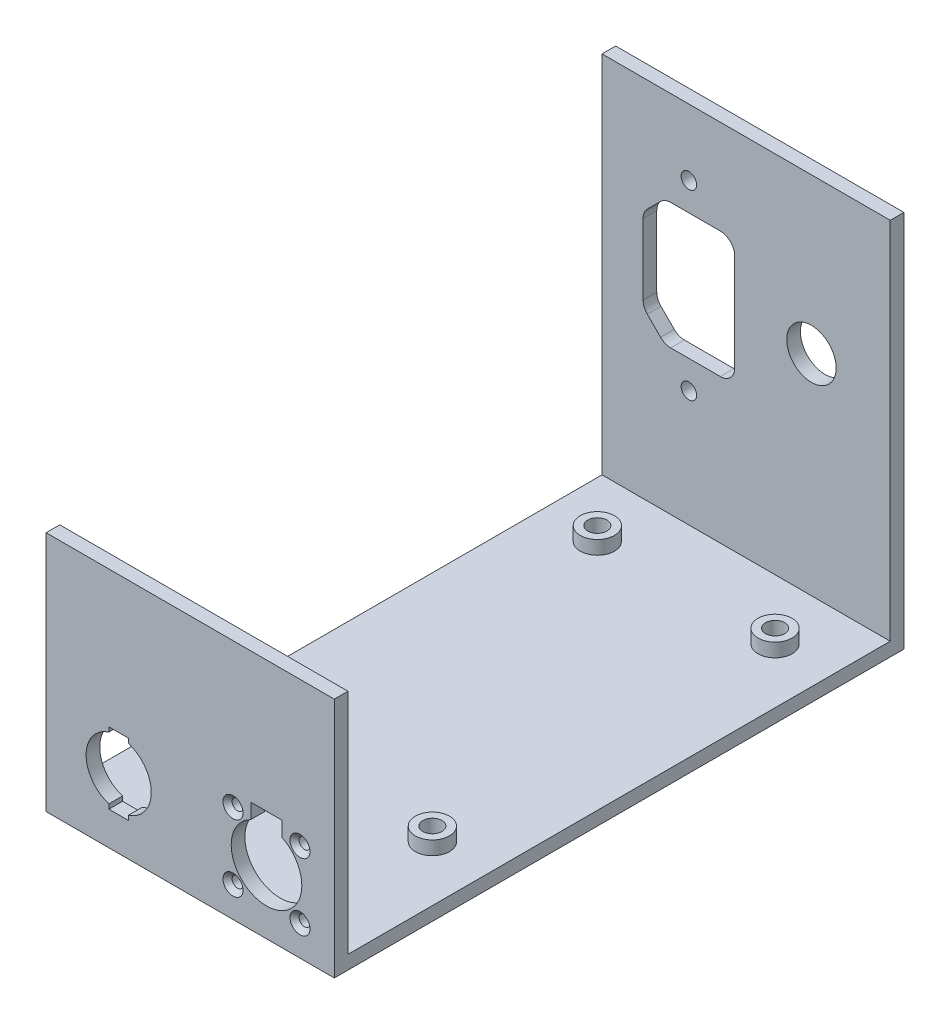
from build123d import *

# Parameters (mm, degrees)
SKETCH_2_R                  = 3.75
EXTRUDE_1_DEPTH             = 3
EXTRUDE_1_2_DEPTH           = 3
EXTRUDE_1_3_DEPTH           = 3
EXTRUDE_1_4_DEPTH           = 3
SKETCH_3_W                  = 63.25
SKETCH_3_H                  = 125
EXTRUDE_2_DEPTH             = 3
SKETCH_4_R                  = 2.1
CUT_EXTRUDE_1_DEPTH         = 4
SKETCH_5_W                  = 63.25
SKETCH_5_H                  = 3
EXTRUDE_3_DEPTH             = 50
CUT_EXTRUDE_2_DEPTH         = 10
HOLE_WIZARD_M21_D           = 2.4
HOLE_WIZARD_M21_DEPTH       = 5
HOLE_WIZARD_M21_CSINK_D     = 4.4
HOLE_WIZARD_M21_CSINK_ANGLE = 90
HOLE_WIZARD_M21_TIP         = 0.721032743
SKETCH_12_W                 = 63.25
SKETCH_12_H                 = 3
EXTRUDE_4_DEPTH             = 80
CUT_EXTRUDE_3_DEPTH         = 148.69272367
HOLE_WIZARD_M31_D           = 3.4
HOLE_WIZARD_M31_DEPTH       = 10
HOLE_WIZARD_M31_TIP         = 1.021463052
SKETCH_16_R                 = 5.425
CUT_EXTRUDE_4_DEPTH         = 148.69272367
CUT_EXTRUDE_5_DEPTH         = 148.69272367


with BuildPart() as part:
    # Эскиз2 → Бобышка-Вытянуть1 (new body)
    with BuildSketch(Plane.XZ):
        with Locations((19.5, 37.6)):
            Circle(SKETCH_2_R)
    extrude(amount=EXTRUDE_1_DEPTH)



with BuildPart() as body_2:
    # Эскиз2 → Extrude 1 2 (new body)
    with BuildSketch(Plane.XZ):
        with Locations((19.5, -37.6)):
            Circle(SKETCH_2_R)
    extrude(amount=EXTRUDE_1_2_DEPTH)


with BuildPart() as body_3:
    # Эскиз2 → Extrude 1 3 (new body)
    with BuildSketch(Plane.XZ):
        with Locations((-19.5, -37.6)):
            Circle(SKETCH_2_R)
    extrude(amount=EXTRUDE_1_3_DEPTH)


with BuildPart() as body_4:
    # Эскиз2 → Extrude 1 4 (new body)
    with BuildSketch(Plane.XZ):
        with Locations((-19.5, 37.6)):
            Circle(SKETCH_2_R)
    extrude(amount=EXTRUDE_1_4_DEPTH)


with BuildPart() as part_1:
    add(part.part)

    add(body_2.part)  # Бобышка-Вытянуть2 merges body 2

    add(body_3.part)  # Бобышка-Вытянуть2 merges body 3

    add(body_4.part)  # Бобышка-Вытянуть2 merges body 4
    # Эскиз3 → Бобышка-Вытянуть2 (add)
    with BuildSketch(Plane.XZ.offset(3)):
        with Locations((0, 8.75)):
            Rectangle(SKETCH_3_W, SKETCH_3_H)
    extrude(amount=EXTRUDE_2_DEPTH)

    # Эскиз4 → Вырез-Вытянуть1 (cut)
    with BuildSketch(Plane(origin=(0, 0, 0), x_dir=(1, 0, 0), z_dir=(0, 1, 0))):
        with Locations((19.5, 37.6)):
            Circle(SKETCH_4_R)
        with Locations((19.5, -37.6)):
            Circle(SKETCH_4_R)
        with Locations((-19.5, -37.6)):
            Circle(SKETCH_4_R)
        with Locations((-19.5, 37.6)):
            Circle(SKETCH_4_R)
    extrude(amount=-CUT_EXTRUDE_1_DEPTH, mode=Mode.SUBTRACT)

    # Эскиз5 → Бобышка-Вытянуть3 (add)
    with BuildSketch(Plane(origin=(0, -3, 0), x_dir=(1, 0, 0), z_dir=(0, 1, 0))):
        with Locations((0, -69.75)):
            Rectangle(SKETCH_5_W, SKETCH_5_H)
    extrude(amount=EXTRUDE_3_DEPTH)

    # Эскиз8 → Вырез-Вытянуть2 (cut)
    with BuildSketch(Plane.XY.offset(71.25)):
        with BuildLine():
            Line((20.195385143, 14.939740629), (20.195385143, 18.25))
            Line((20.195385143, 18.25), (13.295385143, 18.25))
            Line((13.295385143, 18.25), (13.295385143, 14.939740629))
            ThreePointArc((13.295385143, 14.939740629), (16.745385143, 0.25), (20.195385143, 14.939740629))
        make_face()
    extrude(amount=-CUT_EXTRUDE_2_DEPTH, mode=Mode.SUBTRACT)

    # Зенковка для винта с полупотайной головкой M21
    with Locations(Plane.XY.offset(71.25)):
        with Locations((9.395385143, 0.65), (24.095385143, 0.65), (9.395385143, 15.35), (24.095385143, 15.35)):
            CounterSinkHole(HOLE_WIZARD_M21_D / 2, HOLE_WIZARD_M21_CSINK_D / 2, depth=HOLE_WIZARD_M21_DEPTH, counter_sink_angle=HOLE_WIZARD_M21_CSINK_ANGLE)
            with Locations((0, 0, -(HOLE_WIZARD_M21_DEPTH + HOLE_WIZARD_M21_TIP / 2))):  # 118° drill point
                Cone(0, HOLE_WIZARD_M21_D / 2, HOLE_WIZARD_M21_TIP, mode=Mode.SUBTRACT)

    # Эскиз12 → Бобышка-Вытянуть4 (add)
    with BuildSketch(Plane(origin=(0, -3, 0), x_dir=(1, 0, 0), z_dir=(0, 1, 0))):
        with Locations((0, 52.25)):
            Rectangle(SKETCH_12_W, SKETCH_12_H)
    extrude(amount=EXTRUDE_4_DEPTH)

    # Эскиз13 → Вырез-Вытянуть3 (cut, through all)
    with BuildSketch(Plane.XY.offset(-50.75)):
        with BuildLine():
            Line((-16.5475667, 28.661241518), (-5.665207388, 28.661241518))
            ThreePointArc((-5.665207388, 28.661241518), (-3.437821027, 29.583855157), (-2.515207388, 31.811241518))
            Line((-2.515207388, 31.811241518), (-2.515207388, 53.161241518))
            ThreePointArc((-2.515207388, 53.161241518), (-3.437821027, 55.388627878), (-5.665207388, 56.311241518))
            Line((-5.665207388, 56.311241518), (-16.5475667, 56.311241518))
            ThreePointArc((-16.5475667, 56.311241518), (-17.753019512, 56.071462045), (-18.774953061, 55.388627878))
            Line((-18.774953061, 55.388627878), (-21.692593748, 52.470987191))
            ThreePointArc((-21.692593748, 52.470987191), (-22.375427915, 51.449053642), (-22.615207388, 50.243600831))
            Line((-22.615207388, 50.243600831), (-22.615207388, 34.728882205))
            ThreePointArc((-22.615207388, 34.728882205), (-22.375427915, 33.523429393), (-21.692593748, 32.501495844))
            Line((-21.692593748, 32.501495844), (-18.774953061, 29.583855157))
            ThreePointArc((-18.774953061, 29.583855157), (-17.753019512, 28.90102099), (-16.5475667, 28.661241518))
        make_face()
    extrude(amount=-CUT_EXTRUDE_3_DEPTH, mode=Mode.SUBTRACT)

    # Отверстие с зазором M31
    with Locations(Plane(origin=(0, 0, -53.75), x_dir=(-1, 0, 0), z_dir=(0, 0, -1))):
        with Locations((12.565207388, 22.486241518), (12.565207388, 62.486241518)):
            Hole(HOLE_WIZARD_M31_D / 2, depth=HOLE_WIZARD_M31_DEPTH)
            with Locations((0, 0, -(HOLE_WIZARD_M31_DEPTH + HOLE_WIZARD_M31_TIP / 2))):  # 118° drill point
                Cone(0, HOLE_WIZARD_M31_D / 2, HOLE_WIZARD_M31_TIP, mode=Mode.SUBTRACT)

    # Эскиз16 → Вырез-Вытянуть4 (cut, through all)
    with BuildSketch(Plane.XY.offset(-50.75)):
        with Locations((14.332152216, 42.973087252)):
            Circle(SKETCH_16_R)
    extrude(amount=-CUT_EXTRUDE_4_DEPTH, mode=Mode.SUBTRACT)

    # Эскиз17 → Вырез-Вытянуть5 (cut, through all)
    with BuildSketch(Plane(origin=(0, 0, 68.25), x_dir=(-1, 0, 0), z_dir=(0, 0, -1))):
        with BuildLine():
            Line((13.546897834, 15.992570959), (13.546897834, 16.992570959))
            Line((13.546897834, 16.992570959), (17.846897834, 16.992570959))
            Line((17.846897834, 16.992570959), (17.846897834, 15.992570959))
            ThreePointArc((17.846897834, 15.992570959), (22.846897834, 9.17348011), (17.846897834, 2.354389262))
            Line((17.846897834, 2.354389262), (17.846897834, 1.354389262))
            Line((17.846897834, 1.354389262), (13.546897834, 1.354389262))
            Line((13.546897834, 1.354389262), (13.546897834, 2.354389262))
            ThreePointArc((13.546897834, 2.354389262), (8.546897834, 9.17348011), (13.546897834, 15.992570959))
        make_face()
    extrude(amount=-CUT_EXTRUDE_5_DEPTH, mode=Mode.SUBTRACT)


solid = part_1.part
